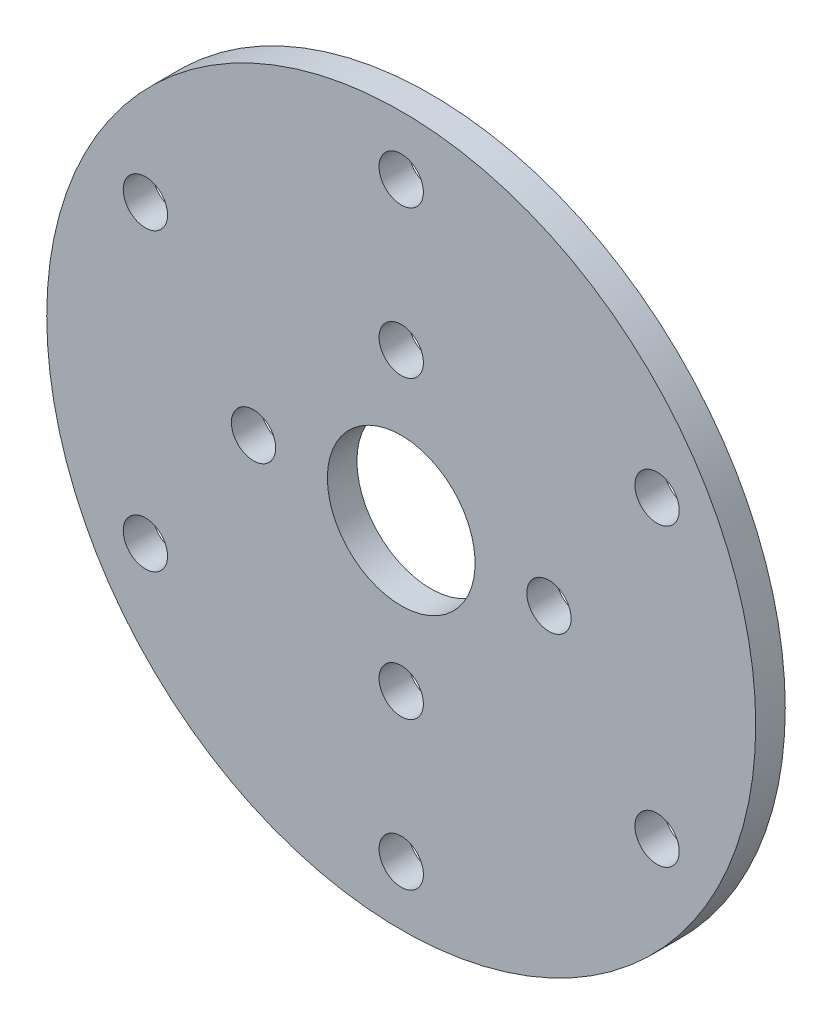
from build123d import *

# Parameters (mm, degrees)
SKETCH_1_R      = 24
SKETCH_1_R_2    = 1.5
SKETCH_1_R_3    = 5
EXTRUDE_1_DEPTH = 2


with BuildPart() as part:
    # 草图1 → 凸台-拉伸1 (new body)
    with BuildSketch(Plane.XY.offset(2)):
        Circle(SKETCH_1_R)
        with Locations((-17.320508076, 10)):
            Circle(SKETCH_1_R_2, mode=Mode.SUBTRACT)
        with Locations((0, -20)):
            Circle(SKETCH_1_R_2, mode=Mode.SUBTRACT)
        with Locations((17.320508076, 10)):
            Circle(SKETCH_1_R_2, mode=Mode.SUBTRACT)
        Circle(SKETCH_1_R_3, mode=Mode.SUBTRACT)
        with Locations((0, 20)):
            Circle(SKETCH_1_R_2, mode=Mode.SUBTRACT)
        with Locations((17.320508076, -10)):
            Circle(SKETCH_1_R_2, mode=Mode.SUBTRACT)
        with Locations((-17.320508076, -10)):
            Circle(SKETCH_1_R_2, mode=Mode.SUBTRACT)
        with Locations((0, 10)):
            Circle(SKETCH_1_R_2, mode=Mode.SUBTRACT)
        with Locations((-10, 0)):
            Circle(SKETCH_1_R_2, mode=Mode.SUBTRACT)
        with Locations((0, -10)):
            Circle(SKETCH_1_R_2, mode=Mode.SUBTRACT)
        with Locations((10, 0)):
            Circle(SKETCH_1_R_2, mode=Mode.SUBTRACT)
    extrude(amount=-EXTRUDE_1_DEPTH)


solid = part.part
